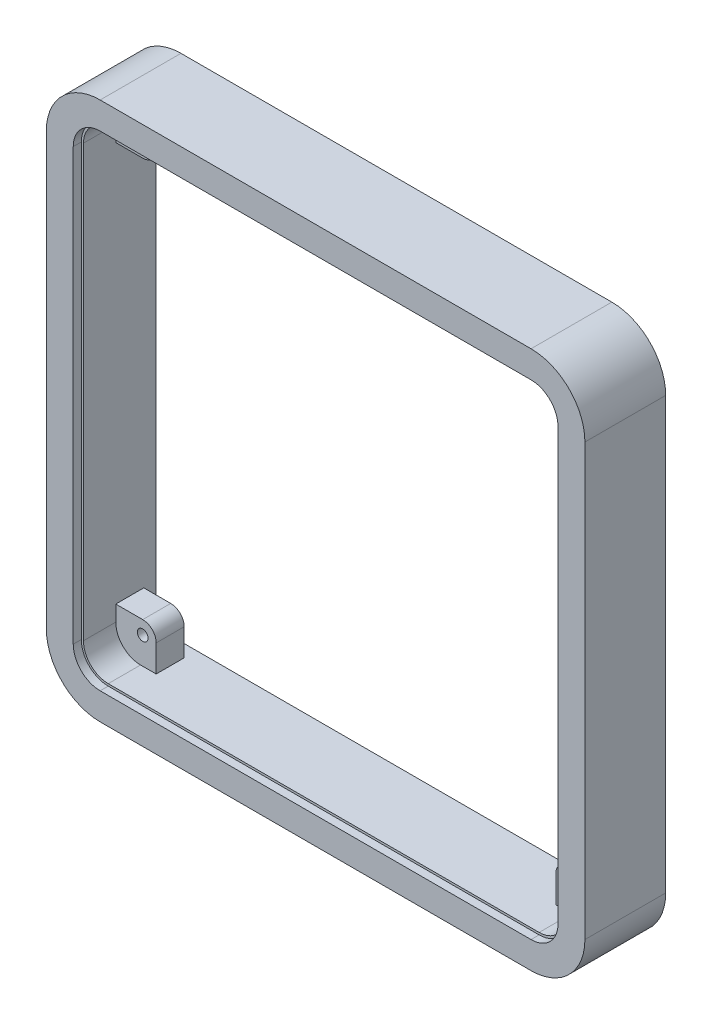
from build123d import *

# Parameters (mm, degrees)
SKETCH2_W                = 200
SKETCH2_H                = 200
BOSS_EXTRUDE1_DEPTH      = 30
FILLET1_R                = 20
CUT_EXTRUDE1_DEPTH       = 3
CUT_EXTRUDE2_DEPTH       = 144.975692393
SKETCH6_W                = 15
SKETCH6_H                = 15
BOSS_EXTRUDE4_DEPTH      = 15
FILLET2_R                = 5
F_4_0_4_DIAMETER_HOLE1_D = 4
CUT_EXTRUDE3_START       = -4.6
CUT_EXTRUDE3_DEPTH       = 4.6


with BuildPart() as part:
    # Sketch2 → Boss-Extrude1 (new body)
    with BuildSketch(Plane.XY):
        Rectangle(SKETCH2_W, SKETCH2_H)
    extrude(amount=BOSS_EXTRUDE1_DEPTH)

    # Fillet1
    fillet1_edges = [part.edges().sort_by_distance(p)[0] for p in [
        (-100, -100, 15),
        (100, -100, 15),
        (100, 100, 15),
        (-100, 100, 15),
    ]]
    fillet(fillet1_edges, radius=FILLET1_R)

    # Sketch3 → Cut-Extrude1 (cut)
    with BuildSketch(Plane.XY.offset(30)):
        with BuildLine():
            Line((-90, 80), (-90, -80))
            ThreePointArc((-90, -80), (-87.071067812, -87.071067812), (-80, -90))
            Line((-80, -90), (80, -90))
            ThreePointArc((80, -90), (87.071067812, -87.071067812), (90, -80))
            Line((90, -80), (90, 80))
            ThreePointArc((90, 80), (87.071067812, 87.071067812), (80, 90))
            Line((80, 90), (-80, 90))
            ThreePointArc((-80, 90), (-87.071067812, 87.071067812), (-90, 80))
        make_face()
    extrude(amount=-CUT_EXTRUDE1_DEPTH, mode=Mode.SUBTRACT)

    # Sketch4 → Cut-Extrude2 (cut, through all)
    with BuildSketch(Plane.XY.offset(27)):
        with BuildLine():
            Line((-89.2, 80), (-89.2, -80))
            ThreePointArc((-89.2, -80), (-86.505382387, -86.505382387), (-80, -89.2))
            Line((-80, -89.2), (80, -89.2))
            ThreePointArc((80, -89.2), (86.505382387, -86.505382387), (89.2, -80))
            Line((89.2, -80), (89.2, 80))
            ThreePointArc((89.2, 80), (86.505382387, 86.505382387), (80, 89.2))
            Line((80, 89.2), (-80, 89.2))
            ThreePointArc((-80, 89.2), (-86.505382387, 86.505382387), (-89.2, 80))
        make_face()
    extrude(amount=-CUT_EXTRUDE2_DEPTH, mode=Mode.SUBTRACT)

    # Sketch6 → Boss-Extrude4 (add)
    with BuildSketch(Plane(origin=(0, 0, 0), x_dir=(-1, 0, 0), z_dir=(0, 0, -1))):
        with Locations((-81.7, -81.7)):
            Rectangle(SKETCH6_W, SKETCH6_H)
        with Locations((-81.7, 81.7)):
            Rectangle(SKETCH6_W, SKETCH6_H)
        with Locations((81.7, 81.7)):
            Rectangle(SKETCH6_W, SKETCH6_H)
        with Locations((81.7, -81.7)):
            Rectangle(SKETCH6_W, SKETCH6_H)
    extrude(amount=-BOSS_EXTRUDE4_DEPTH)

    # Fillet2
    fillet2_edges = [part.edges().sort_by_distance(p)[0] for p in [
        (74.2, -74.2, 7.5),
        (-74.2, -74.2, 7.5),
        (-74.2, 74.2, 7.5),
        (74.2, 74.2, 7.5),
    ]]
    fillet(fillet2_edges, radius=FILLET2_R)

    # Ø4.0 (4) Diameter Hole1 (through all)
    with Locations(Plane(origin=(0, 0, 0), x_dir=(-1, 0, 0), z_dir=(0, 0, -1))):
        with Locations((-79.2, 79.2), (79.2, 79.2), (-79.2, -79.2), (79.2, -79.2)):
            Hole(F_4_0_4_DIAMETER_HOLE1_D / 2)

    # Sketch10 → Cut-Extrude3 (cut)
    with BuildSketch(Plane(origin=(0, 0, 0), x_dir=(-1, 0, 0), z_dir=(0, 0, -1)).offset(CUT_EXTRUDE3_START)):
        with BuildLine():
            Line((89.2, -80), (89.2, 80))
            ThreePointArc((89.2, 80), (86.505382387, 86.505382387), (80, 89.2))
            Line((80, 89.2), (-80, 89.2))
            ThreePointArc((-80, 89.2), (-86.505382387, 86.505382387), (-89.2, 80))
            Line((-89.2, 80), (-89.2, -80))
            ThreePointArc((-89.2, -80), (-86.505382387, -86.505382387), (-80, -89.2))
            Line((-80, -89.2), (80, -89.2))
            ThreePointArc((80, -89.2), (86.505382387, -86.505382387), (89.2, -80))
        make_face()
    extrude(amount=CUT_EXTRUDE3_DEPTH, mode=Mode.SUBTRACT)


solid = part.part
